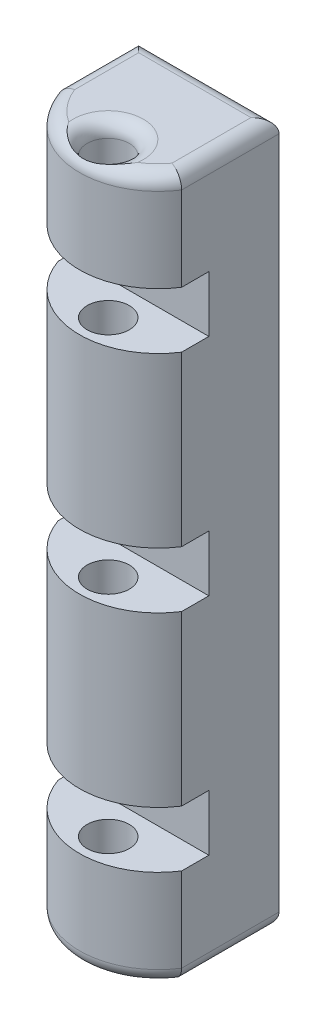
from build123d import *

# Parameters (mm, degrees)
BOSS_EXTRUDE1_DEPTH     = 20
CUT_EXTRUDE1_DEPTH      = 5
SKETCH3_W               = 10
SKETCH3_H               = 50.00000000000001
CUT_EXTRUDE2_DEPTH      = 18.000000000000007
CUT_EXTRUDE3_DEPTH      = 45.955533585978046
CUT_EXTRUDE3_DEPTH_BACK = 45.955533585978046
SKETCH4_R               = 1.5
CUT_EXTRUDE4_DEPTH      = 55.772255750516614
CUT_EXTRUDE4_DEPTH_BACK = 55.772255750516614
FILLET1_R               = 1


with BuildPart() as part:
    # Sketch1 → Boss-Extrude1 (new body)
    with BuildSketch(Plane.XY):
        Polygon((0, 0), (10, 0), (10.000000000000007, -50), (6.12e-15, -50), align=None)
    extrude(amount=BOSS_EXTRUDE1_DEPTH)

    # Sketch2 → Cut-Extrude1 (cut)
    with BuildSketch(Plane.XY.offset(20)):
        Polygon((10.000000000000009, -7), (8.6e-16, -7), (7.6e-16, -11), (10.000000000000005, -11), align=None)
        Polygon((10.000000000000007, -23), (1.47e-15, -23), (3.8e-16, -27), (10.000000000000004, -27), align=None)
        Polygon((10.000000000000005, -39), (1.47e-15, -39), (0, -43), (10.000000000000007, -43), align=None)
    extrude(amount=-CUT_EXTRUDE1_DEPTH, mode=Mode.SUBTRACT)

    # Sketch3 → Cut-Extrude2 (cut)
    with BuildSketch(Plane(origin=(10, 1.39e-15, 0), x_dir=(0, 0, -1), z_dir=(1, 1.4e-16, 0))):
        with Locations((-5, -25.000000000000004)):
            Rectangle(SKETCH3_W, SKETCH3_H)
    extrude(amount=-CUT_EXTRUDE2_DEPTH, mode=Mode.SUBTRACT)

    # Sketch4 → Cut-Extrude3 (cut, two sides: drawn at the far end of the back side and taken through both)
    with BuildSketch(Plane.XZ.offset(39).offset(-CUT_EXTRUDE3_DEPTH_BACK)):
        with Locations(Location((5.260991578815225, 17.426547092913836, 0), (0, 0, 270))):
            Circle(SKETCH4_R)
    extrude(amount=CUT_EXTRUDE3_DEPTH + CUT_EXTRUDE3_DEPTH_BACK, mode=Mode.SUBTRACT)

    # Sketch5 → Cut-Extrude4 (cut, two sides: drawn at the far end of the back side and taken through both)
    with BuildSketch(Plane.XZ.offset(50).offset(-CUT_EXTRUDE4_DEPTH_BACK)):
        with BuildLine():
            Line((6.12e-15, 20), (0, 15.73755811618498))
            ThreePointArc((-8.9e-16, 15.73755811618498), (4.6252026328097955, 19.461842499702882), (10.000000000000007, 16.93709561624879))
            Line((10.000000000000007, 16.93709561624879), (10.000000000000007, 20))
            Line((10.000000000000007, 20), (6.12e-15, 20))
        make_face()
    extrude(amount=CUT_EXTRUDE4_DEPTH + CUT_EXTRUDE4_DEPTH_BACK, mode=Mode.SUBTRACT)

    # Fillet1
    # the kernel refuses this fillet: 1 mm, written as the material it takes off along each edge
    with BuildSketch(Plane(origin=(10, 0, 7.5), x_dir=(-1, 0, 0), z_dir=(0, 0, 1))) as fillet1_piece_1:
        with BuildLine():
            CenterArc((FILLET1_R, FILLET1_R), FILLET1_R, 180, 90)
            Line((0, FILLET1_R), (0, 0))
            Line((0, 0), (FILLET1_R, 0))
        make_face()
    extrude(amount=11.93709561624879, mode=Mode.SUBTRACT)
    with BuildSketch(Plane(origin=(0, 0, 7.5), x_dir=(1, 0, 0), z_dir=(0, 0, 1))) as fillet1_piece_2:
        with BuildLine():
            CenterArc((FILLET1_R, -FILLET1_R), FILLET1_R, 90, 90)
            Line((2.2e-16, -FILLET1_R), (0, 0))
            Line((0, 0), (FILLET1_R, 0))
        make_face()
    extrude(amount=10.737558116184978, mode=Mode.SUBTRACT)
    with BuildSketch(Plane(origin=(6.12e-15, -50, 7.5), x_dir=(-1.3e-16, 1, 0), z_dir=(0, 0, 1))) as fillet1_piece_3:
        with BuildLine():
            CenterArc((FILLET1_R, -FILLET1_R), FILLET1_R, 90, 89.99999999999997)
            Line((-1.3e-16, -FILLET1_R), (0, 0))
            Line((0, 0), (FILLET1_R, 0))
        make_face()
    extrude(amount=10.737558116184978, mode=Mode.SUBTRACT)
    with BuildSketch(Plane(origin=(10.000000000000007, -50, 7.5), x_dir=(0, 1, 0), z_dir=(0, 0, 1))) as fillet1_piece_4:
        with BuildLine():
            CenterArc((FILLET1_R, FILLET1_R), FILLET1_R, 180, 90)
            Line((0, FILLET1_R), (0, 0))
            Line((0, 0), (FILLET1_R, 0))
        make_face()
    extrude(amount=11.93709561624879, mode=Mode.SUBTRACT)
    with BuildSketch(Plane(origin=(5.292490697981418, -50, 13.898964597710425), x_dir=(-0.9937101746292788, 0, -0.11198253809522406), z_dir=(0.11198253809522406, 0, -0.9937101746292788))) as fillet1_piece_5:
        with BuildLine():
            CenterArc((5.602756813783422 - FILLET1_R, FILLET1_R), FILLET1_R, 270, 90)
            Line((5.602756813783423, FILLET1_R), (5.602756813783422, 0))
            Line((5.602756813783422, 0), (5.602756813783422 - FILLET1_R, 0))
        make_face()
    revolve(axis=Axis((5.292490697981418, -50, 13.898964597710425), (0, 1, 0)), revolution_arc=179.17890353520545, mode=Mode.SUBTRACT)
    with BuildSketch(Plane(origin=(5.292490697981418, 0, 13.898964597710425), x_dir=(-0.9937101746292788, 0, -0.11198253809522406), z_dir=(0.11198253809522406, 0, -0.9937101746292788))) as fillet1_piece_6:
        with BuildLine():
            CenterArc((5.602756813783421 - FILLET1_R, -FILLET1_R), FILLET1_R, 0, 90)
            Line((5.602756813783421, -FILLET1_R), (5.602756813783421, 0))
            Line((5.602756813783421, 0), (5.602756813783421 - FILLET1_R, 0))
        make_face()
    revolve(axis=Axis((5.292490697981418, 0, 13.898964597710425), (0, 1, 0)), revolution_arc=179.17890353520545, mode=Mode.SUBTRACT)
    with BuildSketch(Plane(origin=(12.500000000000007, -50, 10), x_dir=(-1.4e-16, 1, 0), z_dir=(-1, -1.4e-16, 0))) as fillet1_piece_7:
        with BuildLine():
            CenterArc((FILLET1_R, -FILLET1_R), FILLET1_R, 90, 90)
            Line((0, -FILLET1_R), (0, 0))
            Line((0, 0), (FILLET1_R, 0))
        make_face()
    extrude(amount=15.000000000000002, mode=Mode.SUBTRACT)
    with BuildSketch(Plane(origin=(12.5, 0, 10), x_dir=(0, 0, 1), z_dir=(-1, -1.4e-16, 0))) as fillet1_piece_8:
        with BuildLine():
            CenterArc((FILLET1_R, -FILLET1_R), FILLET1_R, 90, 90)
            Line((0, -FILLET1_R), (0, 0))
            Line((0, 0), (FILLET1_R, 0))
        make_face()
    extrude(amount=15, mode=Mode.SUBTRACT)
    with BuildSketch(Plane(origin=(5.260991578815225, 0, 17.426547092913836), x_dir=(0, 0, -1), z_dir=(-1, 0, 0))) as fillet1_piece_9:
        with BuildLine():
            CenterArc((1.5 + FILLET1_R, FILLET1_R), FILLET1_R, 180, 90)
            Line((1.5, FILLET1_R), (1.5, 0))
            Line((1.5, 0), (1.5 + FILLET1_R, 0))
        make_face()
    revolve(axis=Axis((5.260991578815225, 0, 17.426547092913836), (0, -1, 0)), mode=Mode.SUBTRACT)
    with BuildSketch(Plane(origin=(5.260991578815225, -50, 17.426547092913836), x_dir=(0, 0, -1), z_dir=(1, 0, 0))) as fillet1_piece_10:
        with BuildLine():
            CenterArc((1.5 + FILLET1_R, FILLET1_R), FILLET1_R, 180, 90)
            Line((1.5, FILLET1_R), (1.5, 0))
            Line((1.5, 0), (1.5 + FILLET1_R, 0))
        make_face()
    revolve(axis=Axis((5.260991578815225, -50, 17.426547092913836), (0, 1, 0)), mode=Mode.SUBTRACT)


solid = part.part
